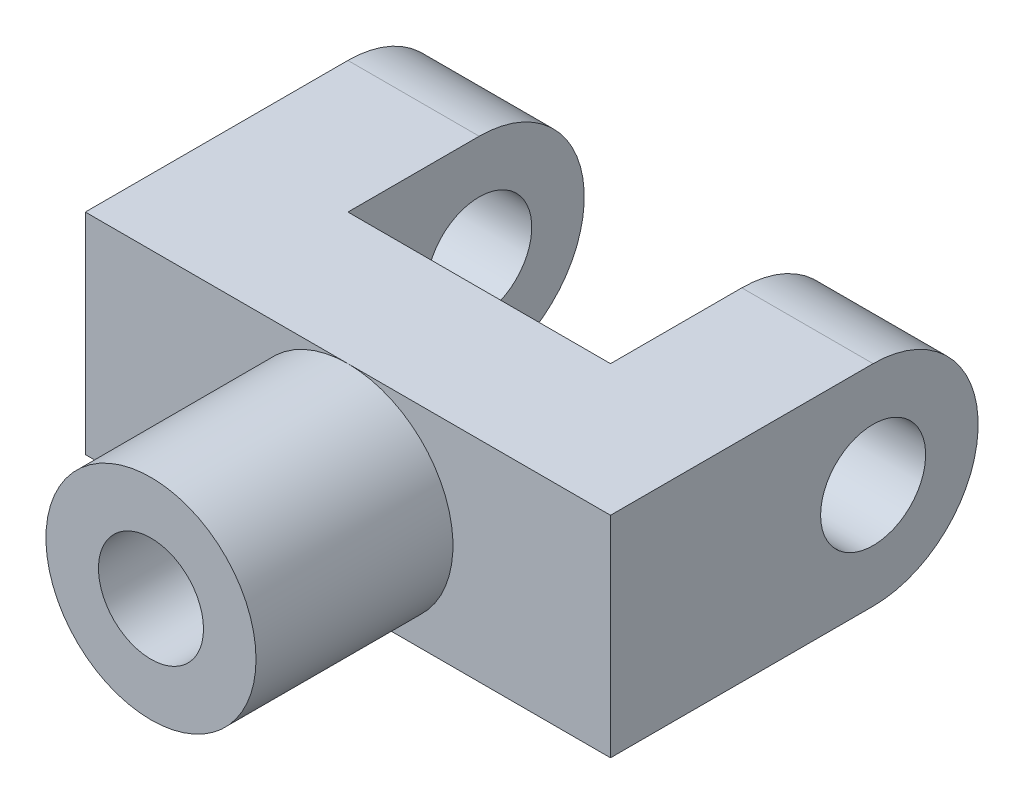
from build123d import *

# Parameters (mm, degrees)
SKETCH1_W           = 20
SKETCH1_H           = 8
BOSS_EXTRUDE1_DEPTH = 2.5
SKETCH1_3_R         = 2
BOSS_EXTRUDE2_DEPTH = 10
SKETCH2_R           = 2
BOSS_EXTRUDE3_DEPTH = 5


with BuildPart() as part:
    # Sketch1 → Boss-Extrude1 (new, symmetric)
    with BuildSketch(Plane.XY):
        Rectangle(SKETCH1_W, SKETCH1_H)
    extrude(amount=BOSS_EXTRUDE1_DEPTH, both=True)

    # Sketch1<3> → Boss-Extrude2 (add)
    with BuildSketch(Plane.XY):
        with BuildLine():
            ThreePointArc((4, 0), (2.828427125, 2.828427125), (0, 4))
            ThreePointArc((0, 4), (-4, 0), (0, -4))
            ThreePointArc((0, -4), (2.828427125, -2.828427125), (4, 0))
        make_face()
        Circle(SKETCH1_3_R, mode=Mode.SUBTRACT)
    extrude(amount=BOSS_EXTRUDE2_DEPTH)

    # Sketch2 → Boss-Extrude3 (add)
    with BuildSketch(Plane.ZY.offset(10)):
        with BuildLine():
            Line((-2.5, -4), (-2.5, 4))
            Line((-2.5, 4), (-7.5, 4))
            ThreePointArc((-7.5, 4), (-11.5, 0), (-7.5, -4))
            Line((-7.5, -4), (-2.5, -4))
        make_face()
        with Locations((-7.5, 0)):
            Circle(SKETCH2_R, mode=Mode.SUBTRACT)
    boss_extrude3 = extrude(amount=-BOSS_EXTRUDE3_DEPTH)

    # Mirror1: Boss-Extrude3 across plane
    add(boss_extrude3.mirror(Plane(origin=(0, 0, 0), x_dir=(0, 0, 1), z_dir=(1, 0, 0))))


solid = part.part
